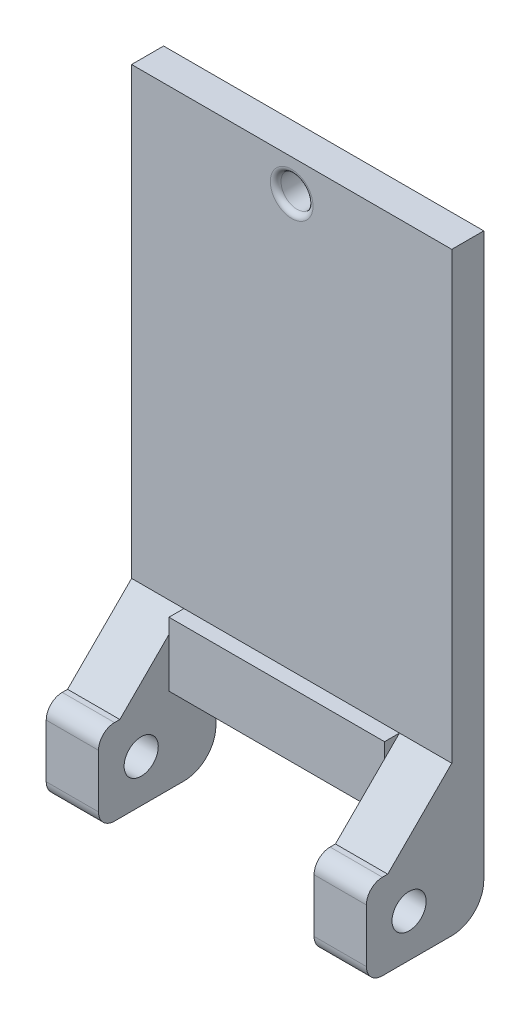
from build123d import *

# Parameters (mm, degrees)
SKETCH1_W               = 30
SKETCH1_H               = 55.7
BOSS_EXTRUDE1_DEPTH     = 3
SKETCH2_W               = 4.9
SKETCH2_H               = 8
BOSS_EXTRUDE2_DEPTH     = 8
SKETCH3_R               = 1.6
CUT_EXTRUDE1_DEPTH      = 43.386583962
SKETCH4_R               = 1.5
CUT_EXTRUDE2_DEPTH      = 10
FILLET3_R               = 0.5
FILLET4_R               = 3
CUT_EXTRUDE4_DEPTH      = 33.628553446
CUT_EXTRUDE4_DEPTH_BACK = 10
FILLET5_R               = 1.5
CHAMFER1_SIZE           = 6
SKETCH6_W               = 20.2
SKETCH6_H               = 6
BOSS_EXTRUDE3_DEPTH     = 1.4


with BuildPart() as part:
    # Sketch1 → Boss-Extrude1 (new body)
    with BuildSketch(Plane.XY):
        Rectangle(SKETCH1_W, SKETCH1_H)
    extrude(amount=BOSS_EXTRUDE1_DEPTH)

    # Sketch2 → Boss-Extrude2 (add)
    with BuildSketch(Plane.XY.offset(3)):
        with Locations((-12.55, -23.85)):
            Rectangle(SKETCH2_W, SKETCH2_H)
    boss_extrude2 = extrude(amount=BOSS_EXTRUDE2_DEPTH)

    # Sketch3 → Cut-Extrude1 (cut, through all)
    with BuildSketch(Plane.ZY.offset(15)):
        with Locations((7, -23.85)):
            Circle(SKETCH3_R)
    cut_extrude1 = extrude(amount=-CUT_EXTRUDE1_DEPTH, mode=Mode.SUBTRACT)

    # Mirror1: Boss-Extrude2, Cut-Extrude1 across plane
    add(boss_extrude2.mirror(Plane(origin=(0, 0, 0), x_dir=(0, 0, 1), z_dir=(1, 0, 0))))
    add(cut_extrude1.mirror(Plane(origin=(0, 0, 0), x_dir=(0, 0, 1), z_dir=(1, 0, 0))), mode=Mode.SUBTRACT)

    # Sketch4 → Cut-Extrude2 (cut)
    with BuildSketch(Plane.XY.offset(3)):
        with Locations((0, 24.85)):
            Circle(SKETCH4_R)
    extrude(amount=-CUT_EXTRUDE2_DEPTH, mode=Mode.SUBTRACT)

    # Fillet3
    fillet3_edges = [part.edges().sort_by_distance(p)[0] for p in [
        (-1.5, 24.85, 0),
        (-1.5, 24.85, 3),
    ]]
    fillet(fillet3_edges, radius=FILLET3_R)

    # Fillet4
    fillet4_edges = [part.edges().sort_by_distance(p)[0] for p in [
        (0, -27.85, 0),
    ]]
    fillet(fillet4_edges, radius=FILLET4_R - 0.0001)  # a hair under: the kernel refuses the full size

    # Sketch5 → Cut-Extrude4 (cut, two sides: drawn at the far end of the back side and taken through both)
    with BuildSketch(Plane.XY.offset(3).offset(-CUT_EXTRUDE4_DEPTH_BACK)):
        Polygon((10.1, -27.85), (10.1, -19.85), (-10.1, -19.85), (-10.1, -27.85), (-10.1, -30.330641118), (10.1, -30.330641118), align=None)
    extrude(amount=CUT_EXTRUDE4_DEPTH + CUT_EXTRUDE4_DEPTH_BACK, mode=Mode.SUBTRACT)

    # Fillet5
    fillet5_edges = [part.edges().sort_by_distance(p)[0] for p in [
        (-12.55, -27.85, 11),
        (-12.55, -19.85, 11),
        (12.55, -19.85, 11),
        (12.55, -27.85, 11),
    ]]
    fillet(fillet5_edges, radius=FILLET5_R)

    # Chamfer1
    chamfer1_edges = [part.edges().sort_by_distance(p)[0] for p in [
        (-12.55, -19.85, 3),
        (12.55, -19.85, 3),
    ]]
    chamfer(chamfer1_edges, length=CHAMFER1_SIZE)

    # Sketch6 → Boss-Extrude3 (add)
    with BuildSketch(Plane.XY.offset(3)):
        with Locations((0, -16.85)):
            Rectangle(SKETCH6_W, SKETCH6_H)
    extrude(amount=BOSS_EXTRUDE3_DEPTH)


solid = part.part
